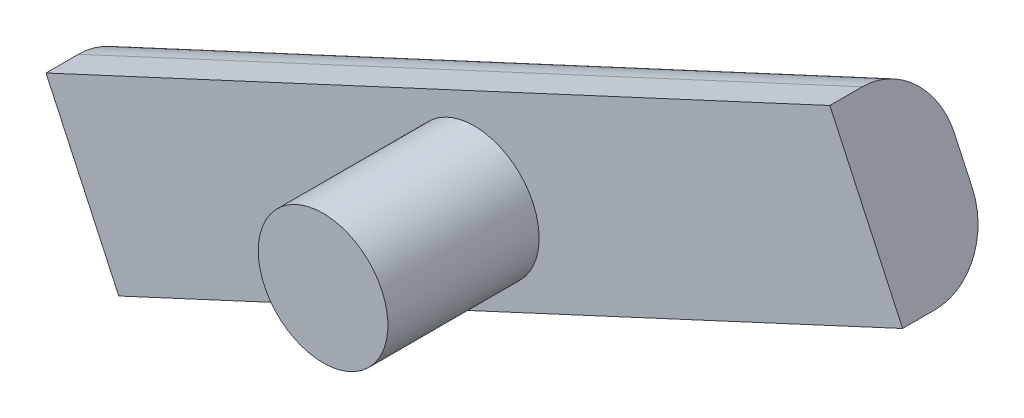
from build123d import *

# Parameters (mm, degrees)
VASTAGO_PROFILE_R = 3
GOMA_START        = 10.5
GOMA_DEPTH        = 4.5
REDONDEO2_R       = 3


with BuildPart() as part:
    # Vastago: sweep along a curve in space
    with BuildLine() as vastago_path:
        Line((455.341566425, 345.362620003, 22), (455.341566425, 345.362620003, 15))
    # Vastago profile (on start of the path) → Vastago (sweep)
    with BuildSketch(Plane(origin=(455.341566425, 345.362620003, 22), x_dir=(-1, 0, 0), z_dir=(0, 0, -1))):
        Circle(VASTAGO_PROFILE_R)
    sweep(path=vastago_path.line)

    # Sk_Goma → Goma (add)
    with BuildSketch(Plane.XY.offset(GOMA_START)):
        Polygon((438.883933324, 333.314951651), (435.516186504, 340.571554255), (471.799199526, 357.410288355), (475.166946345, 350.15368575), align=None)
    extrude(amount=GOMA_DEPTH)

    # Redondeo2
    redondeo2_edges = [part.edges().sort_by_distance(p)[0] for p in [
        (453.657693015, 348.990921305, 10.5),
        (457.025439834, 341.734318701, 10.5),
    ]]
    fillet(redondeo2_edges, radius=REDONDEO2_R)


solid = part.part
